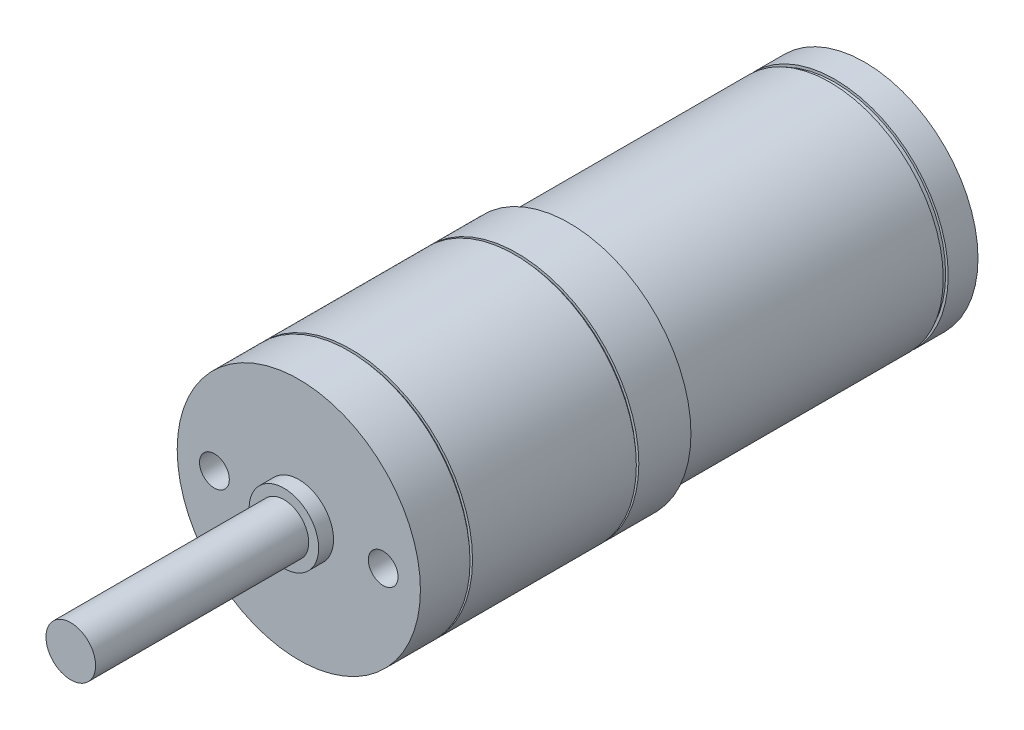
from build123d import *

# Parameters (mm, degrees)
SKETCH1_R           = 12.25
BOSS_EXTRUDE1_DEPTH = 27
SKETCH2_R           = 11.414448149
BOSS_EXTRUDE2_DEPTH = 30
SKETCH3_R           = 2.5
BOSS_EXTRUDE3_DEPTH = 9.4
BOSS_EXTRUDE4_DEPTH = 1
SKETCH5_R           = 0.5
CUT_EXTRUDE1_DEPTH  = 2
SKETCH6_R           = 3.5
BOSS_EXTRUDE5_DEPTH = 1.5
SKETCH7_R           = 3.161406384
BOSS_EXTRUDE6_DEPTH = 1
FILLET1_R           = 1
CUT_EXTRUDE2_START  = -8
CUT_EXTRUDE2_DEPTH  = 8
SKETCH9_R           = 1.5
CUT_EXTRUDE3_DEPTH  = 6
SKETCH10_R          = 12.25
SKETCH10_R_2        = 11.97520775
CUT_EXTRUDE4_DEPTH  = 0.25
CUT_EXTRUDE7_START  = -0.5
SKETCH11_R          = 11.414448149
CUT_EXTRUDE7_DEPTH  = 0.5
FILLET2_R           = 0.5
SKETCH12_R          = 12.25
BOSS_EXTRUDE7_DEPTH = 0.25
SKETCH13_R          = 11.414448149
SKETCH13_R_2        = 11.154427358
CUT_EXTRUDE8_DEPTH  = 0.5
SKETCH3_2_R         = 2.5
BOSS_EXTRUDE8_DEPTH = 22.969653899


with BuildPart() as part:
    # Sketch1 → Boss-Extrude1 (new body)
    with BuildSketch(Plane.XY):
        Circle(SKETCH1_R)
    extrude(amount=-BOSS_EXTRUDE1_DEPTH)

    # Sketch2 → Boss-Extrude2 (add)
    with BuildSketch(Plane(origin=(0, 0, -27), x_dir=(-1, 0, 0), z_dir=(0, 0, -1))):
        Circle(SKETCH2_R)
    extrude(amount=BOSS_EXTRUDE2_DEPTH)

    # Sketch3 → Boss-Extrude3 (add)
    with BuildSketch(Plane.XY):
        Circle(SKETCH3_R)
    extrude(amount=BOSS_EXTRUDE3_DEPTH)

    # Sketch4 → Boss-Extrude4 (add, symmetric)
    with BuildSketch(Plane(origin=(0, 0, 0), x_dir=(0, 0, -1), z_dir=(1, 0, 0))):
        with BuildLine():
            Line((59.668792543, -7.131394742), (55.656453017, -7.131394742))
            ThreePointArc((55.656453017, -7.131394742), (54.525058274, -6), (55.656453017, -4.868605258))
            Line((55.656453017, -4.868605258), (59.668792543, -4.868605258))
            ThreePointArc((59.668792543, -4.868605258), (60.800187285, -6), (59.668792543, -7.131394742))
        make_face()
        with BuildLine():
            Line((59.668792543, 7.131394742), (55.656453017, 7.131394742))
            ThreePointArc((55.656453017, 7.131394742), (54.525058274, 6), (55.656453017, 4.868605258))
            Line((55.656453017, 4.868605258), (59.668792543, 4.868605258))
            ThreePointArc((59.668792543, 4.868605258), (60.800187285, 6), (59.668792543, 7.131394742))
        make_face()
    extrude(amount=BOSS_EXTRUDE4_DEPTH, both=True)

    # Sketch5 → Cut-Extrude1 (cut)
    with BuildSketch(Plane.ZY.offset(1)):
        with Locations((-59.668792543, -6)):
            Circle(SKETCH5_R)
        with Locations((-59.668792543, 6)):
            Circle(SKETCH5_R)
    extrude(amount=-CUT_EXTRUDE1_DEPTH, mode=Mode.SUBTRACT)

    # Sketch6 → Boss-Extrude5 (add)
    with BuildSketch(Plane.XY):
        Circle(SKETCH6_R)
    extrude(amount=BOSS_EXTRUDE5_DEPTH)

    # Sketch7 → Boss-Extrude6 (add)
    with BuildSketch(Plane(origin=(0, 0, -57), x_dir=(-1, 0, 0), z_dir=(0, 0, -1))):
        Circle(SKETCH7_R)
    extrude(amount=BOSS_EXTRUDE6_DEPTH)

    # Fillet1
    fillet1_edges = [part.edges().sort_by_distance(p)[0] for p in [
        (3.161406384, 0, -58),
    ]]
    fillet(fillet1_edges, radius=FILLET1_R - 0.0001)  # a hair under: the kernel refuses the full size

    # Sketch8 → Cut-Extrude2 (cut)
    with BuildSketch(Plane.XY.offset(9.4).offset(CUT_EXTRUDE2_START)):
        with BuildLine():
            Line((-1.842673821, 1.689542302), (1.842673821, 1.689542302))
            ThreePointArc((1.842673821, 1.689542302), (0, 2.5), (-1.842673821, 1.689542302))
        make_face()
    extrude(amount=CUT_EXTRUDE2_DEPTH, mode=Mode.SUBTRACT)

    # Sketch9 → Cut-Extrude3 (cut)
    with BuildSketch(Plane.XY):
        with Locations((-8.5, 0)):
            Circle(SKETCH9_R)
        with Locations((8.5, 0)):
            Circle(SKETCH9_R)
    extrude(amount=-CUT_EXTRUDE3_DEPTH, mode=Mode.SUBTRACT)

    # Sketch10 → Cut-Extrude4 (cut)
    with BuildSketch(Plane.XY.offset(-5)):
        Circle(SKETCH10_R)
        Circle(SKETCH10_R_2, mode=Mode.SUBTRACT)
    cut_extrude4 = extrude(amount=-CUT_EXTRUDE4_DEPTH, mode=Mode.SUBTRACT)

    # Mirror1: Cut-Extrude4 across plane
    add(cut_extrude4.mirror(Plane.XY.offset(-13.5)), mode=Mode.SUBTRACT)

    # Sketch11 → Cut-Extrude7 (cut)
    with BuildSketch(Plane(origin=(0, 0, -27.25), x_dir=(-1, 0, 0), z_dir=(0, 0, -1)).offset(CUT_EXTRUDE7_START)):
        Circle(SKETCH11_R)
    extrude(amount=CUT_EXTRUDE7_DEPTH, mode=Mode.SUBTRACT)


with BuildPart() as cut_extrude7_piece_1:
    # of the separate pieces the step leaves, piece 1, a body of its own (cut_extrude7_pieces)
    add(part.part.solids().sort_by_distance((12.25, 0, -27))[0])



with BuildPart() as cut_extrude7_piece_2:
    # of the separate pieces the step leaves, piece 2, a body of its own (cut_extrude7_pieces)
    add(part.part.solids().sort_by_distance((-3.161406384, 0, -57.0001))[0])

    # Fillet2
    fillet2_edges = [cut_extrude7_piece_2.edges().sort_by_distance(p)[0] for p in [
        (11.414448149, 0, -27.25),
    ]]
    fillet(fillet2_edges, radius=FILLET2_R)


with BuildPart() as cut_extrude7_piece_1_1:
    add(cut_extrude7_piece_1.part)

    add(cut_extrude7_piece_2.part)  # Boss-Extrude7 merges Cut-Extrude7 piece 2
    # Sketch12 → Boss-Extrude7 (add)
    with BuildSketch(Plane(origin=(0, 0, -27), x_dir=(-1, 0, 0), z_dir=(0, 0, -1))):
        with Locations(Location((0, 0, 0), (0, 0, 180))):
            Circle(SKETCH12_R)
    extrude(amount=BOSS_EXTRUDE7_DEPTH)

    # Sketch13 → Cut-Extrude8 (cut)
    with BuildSketch(Plane(origin=(0, 0, -54), x_dir=(-1, 0, 0), z_dir=(0, 0, -1))):
        Circle(SKETCH13_R)
        Circle(SKETCH13_R_2, mode=Mode.SUBTRACT)
    extrude(amount=-CUT_EXTRUDE8_DEPTH, mode=Mode.SUBTRACT)

    # Sketch3<2> → Boss-Extrude8 (add)
    with BuildSketch(Plane.XY):
        Circle(SKETCH3_2_R)
    extrude(amount=BOSS_EXTRUDE8_DEPTH)


solid = cut_extrude7_piece_1_1.part
